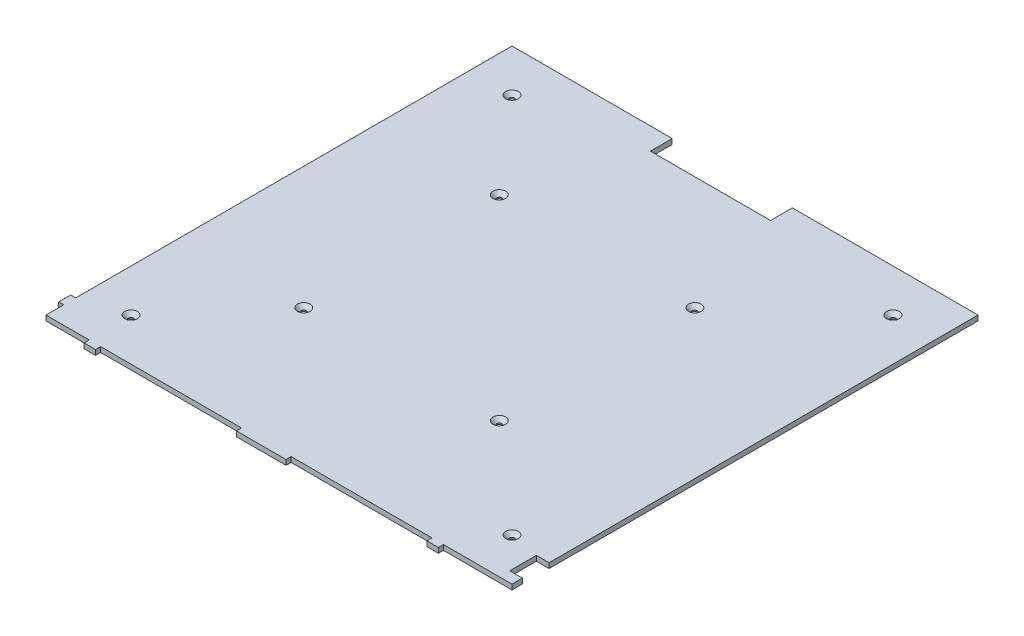
from build123d import *

# Parameters (mm, degrees)
BOSS_EXTRUDE1_DEPTH = 2
SKETCH2_R           = 1
CUT_EXTRUDE1_DEPTH  = 133.597605559
CHAMFER1_SIZE       = 1.5


with BuildPart() as part:
    # Sketch1 → Boss-Extrude1 (new body)
    with BuildSketch(Plane(origin=(0, 0, 0), x_dir=(1, 0, 0), z_dir=(0, 1, 0))):
        Polygon((-74.75, -93.75), (-70.25, -93.75), (-70.25, -91.75), (-14.75, -91.75), (-14.75, -93.75), (4.75, -93.75), (4.75, -91.75), (60.25, -91.75), (60.25, -93.75), (64.75, -93.75), (64.75, -91.75), (91.75, -91.75), (91.75, -87.65), (86.75, -87.65), (86.75, -77.15), (91.75, -77.15), (91.75, 91.75), (18.65, 91.75), (18.65, 83.15), (-28.65, 83.15), (-28.65, 91.75), (-91.75, 91.75), (-91.75, -80.05), (-93.75, -80.05), (-93.75, -84.75), (-91.75, -84.75), (-91.75, -91.75), (-74.75, -91.75), align=None)
    extrude(amount=BOSS_EXTRUDE1_DEPTH)

    # Sketch2 → Cut-Extrude1 (cut, through all)
    with BuildSketch(Plane.XZ):
        with Locations((75, -75)):
            Circle(SKETCH2_R)
        with Locations((-75, -75)):
            Circle(SKETCH2_R)
        with Locations((-75, 75)):
            Circle(SKETCH2_R)
        with Locations((75, 75)):
            Circle(SKETCH2_R)
        with Locations((33.5, 38.5)):
            Circle(SKETCH2_R)
        with Locations((-43.5, 38.5)):
            Circle(SKETCH2_R)
        with Locations((-43.5, -38.5)):
            Circle(SKETCH2_R)
        with Locations((33.5, -38.5)):
            Circle(SKETCH2_R)
    extrude(amount=-CUT_EXTRUDE1_DEPTH, mode=Mode.SUBTRACT)

    # Chamfer1
    chamfer1_edges = [part.edges().sort_by_distance(p)[0] for p in [
        (74, 2, 75),
        (-76, 2, 75),
        (-44.5, 2, 38.5),
        (32.5, 2, 38.5),
        (32.5, 2, -38.5),
        (-44.5, 2, -38.5),
        (74, 2, -75),
        (-76, 2, -75),
    ]]
    chamfer(chamfer1_edges, length=CHAMFER1_SIZE)


solid = part.part
